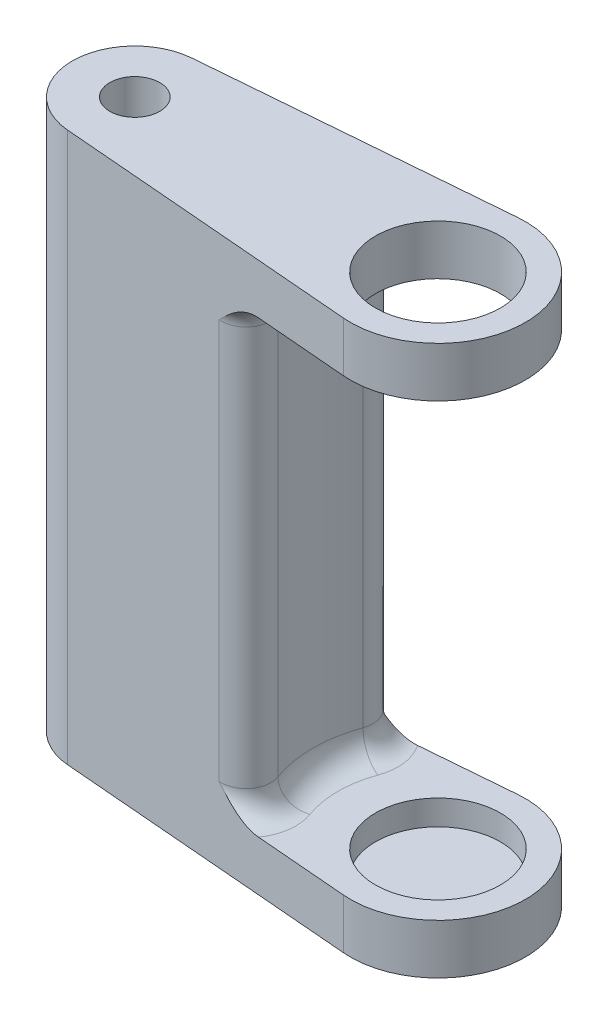
from build123d import *

# Parameters (mm, degrees)
SKETCH1_R               = 1
SKETCH1_R_2             = 2.5
BOSS_EXTRUDE5_DEPTH     = 2
SKETCH1_7_R             = 2.5
SKETCH1_7_R_2           = 1
BOSS_EXTRUDE6_DEPTH     = 22
BOSS_EXTRUDE7_START     = 20
BOSS_EXTRUDE7_OUTLINE_R = 2.5
BOSS_EXTRUDE7_DEPTH     = 2
SKETCH1_9_R             = 2.5
BOSS_EXTRUDE8_DEPTH     = 1
FILLET3_R               = 1
FILLET1_R               = 1


# Read off the part's stored shape, not the designer's step: Boss-Extrude7
with BuildPart() as part:
    # Sketch1 → Boss-Extrude5 (new body)
    with BuildSketch(Plane(origin=(0, 0, 0), x_dir=(1, 0, 0), z_dir=(0, 1, 0))):
        with BuildLine():
            ThreePointArc((-0.206033327, 2.491495589), (-2.5, 0), (-0.206033327, -2.491495589))
            Line((-0.206033327, -2.491495589), (11.845512634, -3.488093824))
            ThreePointArc((11.845512634, -3.488093824), (15.633959292, 0), (11.845512634, 3.488093824))
            Line((11.845512634, 3.488093824), (-0.206033327, 2.491495589))
        make_face()
        with Locations(Location((0, 0, 0), (0, 0, 270))):
            Circle(SKETCH1_R, mode=Mode.SUBTRACT)
        with Locations(Location((12.133959292, 0, 0), (0, 0, 270))):
            Circle(SKETCH1_R_2, mode=Mode.SUBTRACT)
    extrude(amount=BOSS_EXTRUDE5_DEPTH)

    # Sketch1<7> → Boss-Extrude6 (add)
    # profile 1 of 2: a face of its own
    with BuildSketch(Plane(origin=(0, 0, 0), x_dir=(1, 0, 0), z_dir=(0, 1, 0))):
        Circle(SKETCH1_7_R)
        with Locations(Location((0, 0, 0), (0, 0, 270))):
            Circle(SKETCH1_7_R_2, mode=Mode.SUBTRACT)
    # profile 2 of 2: a face of its own
    with BuildSketch(Plane(origin=(0, 0, 0), x_dir=(1, 0, 0), z_dir=(0, 1, 0))):
        with BuildLine():
            Line((8.286945149, 3.193819373), (-0.206033327, 2.491495589))
            ThreePointArc((-0.206033327, 2.491495589), (1.693357122, 1.839168741), (2.5, 0))
            ThreePointArc((2.5, 0), (1.693357122, -1.839168741), (-0.206033327, -2.491495589))
            Line((-0.206033327, -2.491495589), (8.286945149, -3.193819373))
            ThreePointArc((8.286945149, -3.193819373), (7.133959292, 0), (8.286945149, 3.193819373))
        make_face()
    extrude(amount=BOSS_EXTRUDE6_DEPTH)

    # Boss-Extrude7 outline → Boss-Extrude7 (add)
    with BuildSketch(Plane(origin=(0, 0, 0), x_dir=(1, 0, 0), z_dir=(0, 1, 0)).offset(BOSS_EXTRUDE7_START)):
        with BuildLine():
            Line((8.286945149, -3.193819373), (11.845512634, -3.488093824))
            ThreePointArc((11.845512634, -3.488093824), (15.633959292, 0), (11.845512634, 3.488093824))
            Line((11.845512634, 3.488093824), (8.286945149, 3.193819373))
            ThreePointArc((8.286945149, 3.193819373), (7.133959292, 0), (8.286945149, -3.193819373))
        make_face()
        with Locations((12.133959292, 0)):
            Circle(BOSS_EXTRUDE7_OUTLINE_R, mode=Mode.SUBTRACT)
    extrude(amount=BOSS_EXTRUDE7_DEPTH)

    # Sketch1<9> → Boss-Extrude8 (add)
    with BuildSketch(Plane(origin=(0, 0, 0), x_dir=(1, 0, 0), z_dir=(0, 1, 0))):
        with Locations(Location((12.133959292, 0, 0), (0, 0, 270))):
            Circle(SKETCH1_9_R)
    extrude(amount=BOSS_EXTRUDE8_DEPTH)

    # Fillet3
    # the kernel refuses this fillet: 1 mm, written as the material it takes off along each edge
    with BuildSketch(Plane(origin=(8.286945149, 2, 3.193819373), x_dir=(-0.49694917619000334, 0, -0.8677796473091985), z_dir=(0, 1, 0))) as fillet3_piece_1:
        with BuildLine():
            CenterArc((1.891474067, 0.985105296), FILLET3_R, 145.474338823, 114.624318352)
            Line((1.067601639, 1.55188058), (0, 0))
            ThreePointArc((0, 0), (0.85976094, 0.074473518), (1.719521879, 0))
        make_face()
    extrude(amount=18, mode=Mode.SUBTRACT)
    with BuildSketch(Plane(origin=(8.286945149, 2, -3.193819373), x_dir=(-0.9965982354592262, 0, 0.08241333071510189), z_dir=(0, 1, 0))) as fillet3_piece_2:
        with BuildLine():
            CenterArc((1.883641843, 1), FILLET3_R, 155.375681648, 114.624318352)
            ThreePointArc((0.9745825, 1.416666667), (0.548647928, 0.666123584), (0, 0))
            Line((0, 0), (1.883641843, 0))
        make_face()
    extrude(amount=18, mode=Mode.SUBTRACT)

    # Fillet1
    # the kernel refuses this fillet: 1 mm, written as the material it adds along each edge
    with BuildSketch(Plane(origin=(12.133959294, 20, 0), x_dir=(-0.9403058248886403, 0, -0.34033065639241744), z_dir=(0.34033065639241744, 0, -0.9403058248886403))) as fillet1_piece_1:
        with BuildLine():
            CenterArc((5.000000002 - FILLET1_R, -FILLET1_R), FILLET1_R, 0, 90)
            Line((5.000000002 - FILLET1_R, 0), (5.000000002, 0))
            Line((5.000000002, 0), (5.000000002, -FILLET1_R))
        make_face()
    revolve(axis=Axis((12.133959294, 20, 0), (0, 1, 0)), revolution_arc=39.794041437)
    with BuildSketch(Plane(origin=(12.133959292, 2, 0), x_dir=(-0.9403058248462457, 0, 0.3403306565095503), z_dir=(0.3403306565095503, 0, 0.9403058248462457))) as fillet1_piece_2:
        with BuildLine():
            CenterArc((5 - FILLET1_R, -FILLET1_R), FILLET1_R, 0, 90)
            Line((5 - FILLET1_R, 0), (5, 0))
            Line((5, 0), (5, -FILLET1_R))
        make_face()
    revolve(axis=Axis((12.133959292, 2, 0), (0, -1, 0)), revolution_arc=39.794041451)
    with BuildSketch(Plane(origin=(6.492124343, 2, -2.041983939), x_dir=(0.9403058248461986, 0, 0.34033065650968036), z_dir=(-0.34033065650968036, 0, 0.9403058248461986))) as fillet1_piece_3_section:
        with BuildLine():
            CenterArc((1 + FILLET1_R, FILLET1_R), FILLET1_R, 180, 90)
            Line((1 + FILLET1_R, 0), (1, 0))
            Line((1, 0), (1, FILLET1_R))
        make_face()
    fillet1_piece_3 = revolve(axis=Axis((6.492124343, 2, -2.041983939), (0, 1, 0)), revolution_arc=257.957117876, mode=Mode.PRIVATE)
    fillet1_piece_3 = split(fillet1_piece_3, bisect_by=Plane(origin=(7.34883742, 2.262262875, -3.116242893), z_dir=(0.08241333071510651, 0, 0.9965982354592259)), keep=Keep.TOP, mode=Mode.PRIVATE)
    add(fillet1_piece_3)
    with BuildSketch(Plane(origin=(6.492124343, 20, -2.041983939), x_dir=(0.9403058248461986, 0, 0.34033065650968036), z_dir=(-0.34033065650968036, 0, 0.9403058248461986))) as fillet1_piece_4_section:
        with BuildLine():
            CenterArc((1 + FILLET1_R, -FILLET1_R), FILLET1_R, 90, 90)
            Line((1, -FILLET1_R), (1, 0))
            Line((1, 0), (1 + FILLET1_R, 0))
        make_face()
    fillet1_piece_4 = revolve(axis=Axis((6.492124343, 20, -2.041983939), (0, 1, 0)), revolution_arc=257.957117876, mode=Mode.PRIVATE)
    fillet1_piece_4 = split(fillet1_piece_4, bisect_by=Plane(origin=(7.693506276, 19.839747829, -3.14474516), z_dir=(0.08241333071510651, 0, 0.9965982354592259)), keep=Keep.TOP, mode=Mode.PRIVATE)
    add(fillet1_piece_4)
    with BuildSketch(Plane(origin=(6.492124343, 2, 2.041983939), x_dir=(-0.5290294610510079, 0, -0.8486034582418812), z_dir=(0.8486034582418812, 0, -0.5290294610510079))) as fillet1_piece_5_section:
        with BuildLine():
            CenterArc((1 + FILLET1_R, FILLET1_R), FILLET1_R, 180, 90)
            Line((1 + FILLET1_R, 0), (1, 0))
            Line((1, 0), (1, FILLET1_R))
        make_face()
    fillet1_piece_5 = revolve(axis=Axis((6.492124343, 2, 2.041983939), (0, 1, 0)), revolution_arc=257.957117876, mode=Mode.PRIVATE)
    fillet1_piece_5 = split(fillet1_piece_5, bisect_by=Plane(origin=(7.348749187, 2.26222623, 3.116235597), z_dir=(0.08241333071510651, 0, -0.9965982354592259)), keep=Keep.TOP, mode=Mode.PRIVATE)
    add(fillet1_piece_5)
    with BuildSketch(Plane(origin=(6.492124343, 20, 2.041983939), x_dir=(-0.5290294610510079, 0, -0.8486034582418812), z_dir=(0.8486034582418812, 0, -0.5290294610510079))) as fillet1_piece_6_section:
        with BuildLine():
            CenterArc((1 + FILLET1_R, -FILLET1_R), FILLET1_R, 90, 90)
            Line((1 + FILLET1_R, 0), (1, 0))
            Line((1, 0), (1, -FILLET1_R))
        make_face()
    fillet1_piece_6 = revolve(axis=Axis((6.492124343, 20, 2.041983939), (0, 1, 0)), revolution_arc=257.957117876, mode=Mode.PRIVATE)
    fillet1_piece_6 = split(fillet1_piece_6, bisect_by=Plane(origin=(7.34874918, 19.737773776, 3.116235596), z_dir=(0.08241333071510651, 0, -0.9965982354592259)), keep=Keep.TOP, mode=Mode.PRIVATE)
    add(fillet1_piece_6)


solid = part.part
